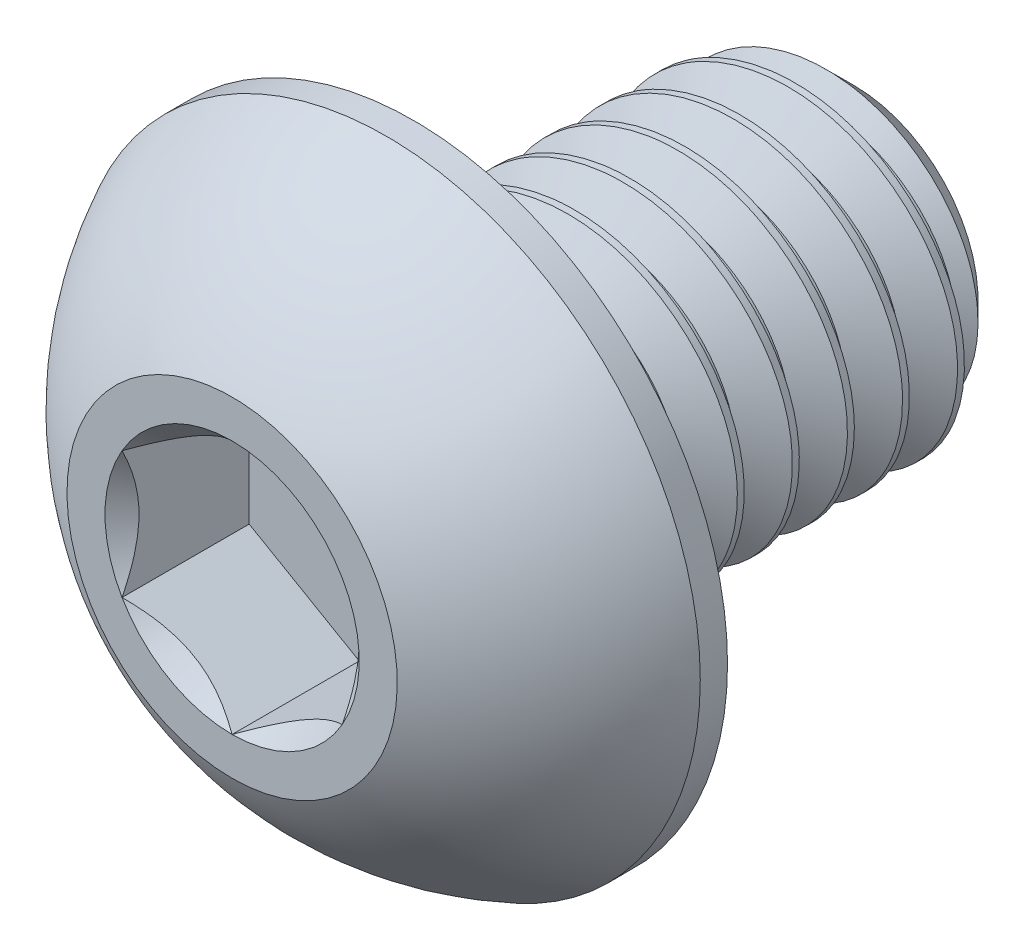
from build123d import *

# Parameters (mm, degrees)
SKETCH1_W          = 4
SKETCH1_H          = 1.5
CHAMFER1_SIZE      = 0.375
CUT_SWEEP1_PITCH   = 0.5
CUT_EXTRUDE2_DEPTH = 1.155


with BuildPart() as part:
    # Sketch1 → Revolve1 (revolve)
    with BuildSketch(Plane(origin=(0, 0, 0), x_dir=(0, 0, -1), z_dir=(1, 0, 0))):
        with Locations((3.65, 0.75)):
            Rectangle(SKETCH1_W, SKETCH1_H)
    revolve(axis=Axis((0, 0, -5.65), (0, 0, 1)))

    # Chamfer1
    chamfer1_edges = [part.edges().sort_by_distance(p)[0] for p in [
        (0, -1.5, -5.65),
    ]]
    chamfer(chamfer1_edges, length=CHAMFER1_SIZE)

    # Cut-Sweep1: arcs per turn and ends read off the stored shape
    # Cut-Sweep1: the profile of Sketch2 profile screwed along a right-hand helix through 9 turns, 6 arcs to a turn; built about Z, then put on its axis
    cut_sweep1_z = Axis((0, 0, 0), (0, 0, 1))
    cut_sweep1_corners = [(1.5003, 0, 0.000173213), (1.5003, 0, -0.437673198), (1.175240474, 0, -0.249999993), (1.175240474, 0, -0.187499993)]
    with BuildLine(mode=Mode.PRIVATE) as cut_sweep1_profile:
        Line(cut_sweep1_corners[0], cut_sweep1_corners[1])
        Line(cut_sweep1_corners[1], cut_sweep1_corners[2])
        Line(cut_sweep1_corners[2], cut_sweep1_corners[3])
        Line(cut_sweep1_corners[3], cut_sweep1_corners[0])
    cut_sweep1_cap = Face(cut_sweep1_profile.wire())
    cut_sweep1_turn_angles = [0, 30, 60, 90, 120, 150, 180, 210, 240, 270, 300, 330, 360]
    cut_sweep1_turn_weights = [1, 0.8660254037844387, 1, 0.8660254037844387, 1, 0.8660254037844387, 1, 0.8660254037844387, 1, 0.8660254037844387, 1, 0.8660254037844387, 1]
    cut_sweep1_turn_rails = [Edge.make_bspline([Vector(p[0], p[1], 0).rotate(cut_sweep1_z, cut_sweep1_turn_angles[k]) / cut_sweep1_turn_weights[k] + Vector(0, 0, p[2] + CUT_SWEEP1_PITCH * cut_sweep1_turn_angles[k] / 360) for k in range(13)], [0, 0, 0, 1, 1, 2, 2, 3, 3, 4, 4, 5, 5, 6, 6, 6], 2, cut_sweep1_turn_weights) for p in cut_sweep1_corners]
    cut_sweep1_turn_sides = [Face.make_surface_from_curves(cut_sweep1_turn_rails[p[0]], cut_sweep1_turn_rails[p[1]]) for p in [(0, 1), (1, 2), (2, 3), (3, 0)]]
    cut_sweep1 = Plane(origin=(0, 0, -5.65), x_dir=(1, 0, 0), z_dir=(0, 0, 1)) * Solid(Shell([*[p.moved(Location((0, 0, CUT_SWEEP1_PITCH * i))) for i in range(9) for p in cut_sweep1_turn_sides], cut_sweep1_cap, cut_sweep1_cap.rotate(cut_sweep1_z, 3240).moved(Location((0, 0, CUT_SWEEP1_PITCH * 3240 / 360)))]))
    add(cut_sweep1, mode=Mode.SUBTRACT)

    # Sketch7 → Revolve2 (revolve)
    with BuildSketch(Plane(origin=(0, 0, 0), x_dir=(0, 0, -1), z_dir=(1, 0, 0)), mode=Mode.PRIVATE) as revolve2_sk:
        with BuildLine():
            Line((1.4025, 2.85), (1.65, 2.85))
            Line((1.65, 2.85), (1.65, 0))
            Line((1.65, 0), (0, 0))
            Line((0, 0), (0, 1.5))
            ThreePointArc((0, 1.5), (0.59512511, 2.285251969), (1.4025, 2.85))
        make_face()
    revolve(revolve2_sk.sketch.rotate(Axis((0, 0, 0), (0, 0, -1)), 180), axis=Axis((0, 0, 0), (0, 0, -1)))

    # Sketch5 → Cut-Extrude2 (cut)
    with BuildSketch(Plane.XY):
        Polygon((1, -0.577350269), (1, 0.577350269), (0, 1.154700538), (-1, 0.577350269), (-1, -0.577350269), (0, -1.154700538), align=None)
    extrude(amount=-CUT_EXTRUDE2_DEPTH, mode=Mode.SUBTRACT)

    # Cut-Extrude3 cone 1 section (through the dimple's axis) → Cut-Extrude3 (revolve, cut)
    with BuildSketch(Plane(origin=(0, 0, 0), x_dir=(0, -1, 0), z_dir=(1, 0, 0))):
        Polygon((0, 0), (1.154700538, 0), (0, 1.154700538), align=None)
    revolve(axis=Axis((0, 0, 0), (0, 0, -1)), mode=Mode.SUBTRACT)


solid = part.part
